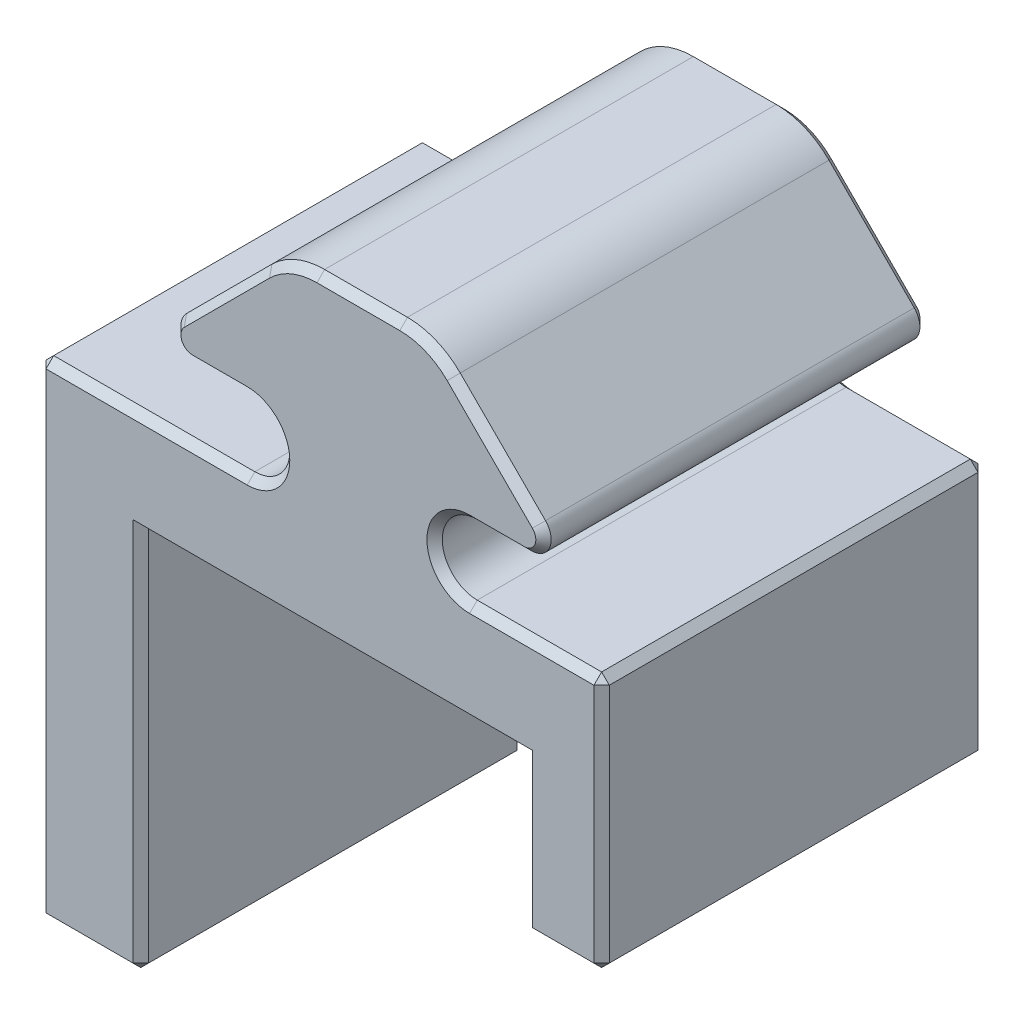
from build123d import *

# Parameters (mm, degrees)
BOSS_EXTRUDE1_DEPTH = 15
SKETCH2_W           = 4
SKETCH2_H           = 15
BOSS_EXTRUDE2_DEPTH = 15
SKETCH3_W           = 3
SKETCH3_H           = 15
BOSS_EXTRUDE3_DEPTH = 6
CHAMFER1_SIZE       = 0.3


with BuildPart() as part:
    # Sketch1 → Boss-Extrude1 (new body)
    with BuildSketch(Plane.XY):
        with BuildLine():
            Line((4.343399971, -3.3621), (5.0570836, -3.3621))
            Line((5.0570836, -3.3621), (9.5, -3.3621))
            Line((9.5, -3.3621), (9.5, -7.3621))
            Line((9.5, -7.3621), (-12.5, -7.3621))
            Line((-12.5, -7.3621), (-12.5, -3.3621))
            Line((-12.5, -3.3621), (-5.0570836, -3.3621))
            Line((-5.0570836, -3.3621), (-4.3434, -3.3621))
            ThreePointArc((-4.3434, -3.3621), (-2.9785, -1.9972), (-4.3434, -0.6323))
            Line((-4.3434, -0.6323), (-6.474794456, -0.6323))
            ThreePointArc((-6.474794456, -0.6323), (-7.173247382, -0.165608675), (-7.009367182, 0.658272727))
            Line((-7.009367182, 0.658272727), (-3.679323642, 3.988316267))
            ThreePointArc((-3.679323642, 3.988316267), (-2.73362958, 4.620208837), (-1.618107374, 4.8421))
            Line((-1.618107374, 4.8421), (1.618107374, 4.8421))
            ThreePointArc((1.618107374, 4.8421), (2.73362958, 4.620208837), (3.679323642, 3.988316267))
            Line((3.679323642, 3.988316267), (7.009367182, 0.658272727))
            ThreePointArc((7.009367182, 0.658272727), (7.173247382, -0.165608675), (6.474794456, -0.6323))
            Line((6.474794456, -0.6323), (4.343399971, -0.6323))
            ThreePointArc((4.343399971, -0.6323), (2.978499971, -1.9972), (4.343399971, -3.3621))
        make_face()
    extrude(amount=BOSS_EXTRUDE1_DEPTH)

    # Sketch2 → Boss-Extrude2 (add)
    with BuildSketch(Plane.XZ.offset(7.3621)):
        with Locations((-10.5, 7.5)):
            Rectangle(SKETCH2_W, SKETCH2_H)
    extrude(amount=BOSS_EXTRUDE2_DEPTH)

    # Sketch3 → Boss-Extrude3 (add)
    with BuildSketch(Plane.XZ.offset(7.3621)):
        with Locations((8, 7.5)):
            Rectangle(SKETCH3_W, SKETCH3_H)
    extrude(amount=BOSS_EXTRUDE3_DEPTH)

    # Chamfer1
    chamfer1_edges = [part.edges().sort_by_distance(p)[0] for p in [
        (-10.5, -22.3621, 0),
        (-8.5, -14.8621, 0),
        (-1, -7.3621, 0),
        (6.5, -10.3621, 0),
        (8, -13.3621, 0),
        (9.5, -8.3621, 0),
        (6.921699986, -3.3621, 0),
        (2.978499971, -1.9972, 0),
        (5.409097213, -0.6323, 0),
        (7.173247382, -0.165608675, 0),
        (5.344345412, 2.323294497, 0),
        (2.73362958, 4.620208837, 0),
        (0, 4.8421, 0),
        (-2.73362958, 4.620208837, 0),
        (-5.344345412, 2.323294497, 0),
        (-7.173247382, -0.165608675, 0),
        (-5.409097228, -0.6323, 0),
        (-2.9785, -1.9972, 0),
        (-8.4217, -3.3621, 0),
        (-12.5, -12.8621, 0),
        (-2.9785, -1.9972, 15),
        (-5.409097228, -0.6323, 15),
        (-7.173247382, -0.165608675, 15),
        (-5.344345412, 2.323294497, 15),
        (-2.73362958, 4.620208837, 15),
        (0, 4.8421, 15),
        (2.73362958, 4.620208837, 15),
        (5.344345412, 2.323294497, 15),
        (7.173247382, -0.165608675, 15),
        (5.409097213, -0.6323, 15),
        (2.978499971, -1.9972, 15),
        (6.921699986, -3.3621, 15),
        (9.5, -8.3621, 15),
        (8, -13.3621, 15),
        (6.5, -10.3621, 15),
        (-1, -7.3621, 15),
        (-8.5, -14.8621, 15),
        (-10.5, -22.3621, 15),
        (-12.5, -12.8621, 15),
        (-8.4217, -3.3621, 15),
        (-12.5, -22.3621, 7.5),
        (-8.5, -22.3621, 7.5),
        (6.5, -13.3621, 7.5),
        (9.5, -13.3621, 7.5),
        (9.5, -3.3621, 7.5),
        (-12.5, -3.3621, 7.5),
    ]]
    chamfer(chamfer1_edges, length=CHAMFER1_SIZE)


solid = part.part
